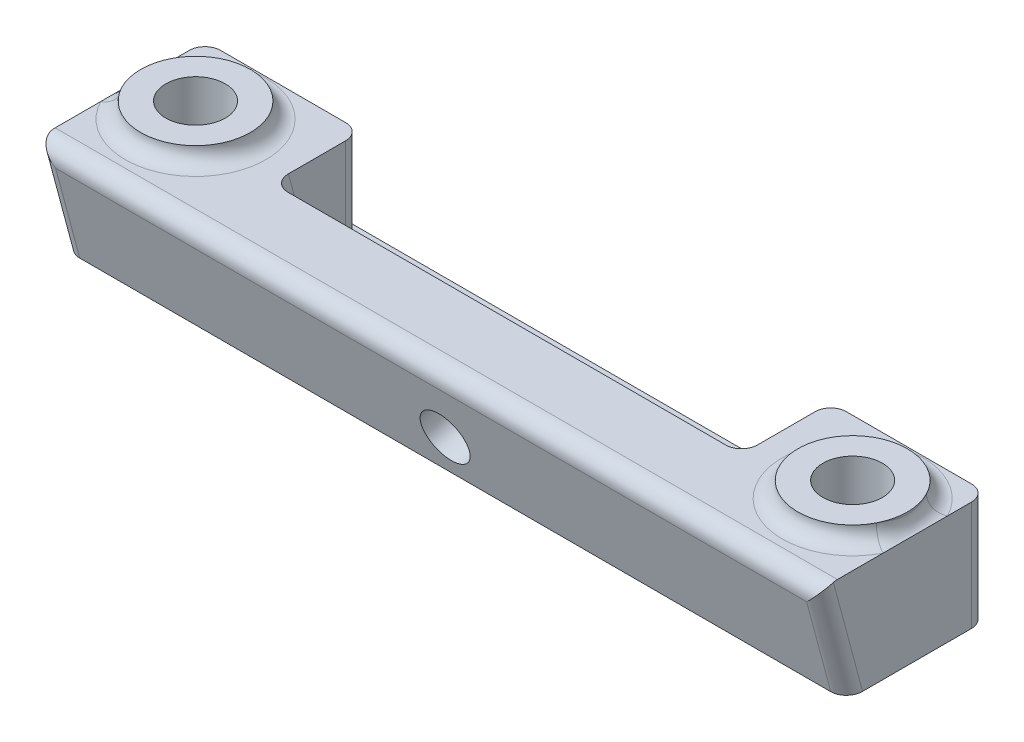
from build123d import *

# Parameters (mm, degrees)
BOSS_EXTRU_1_DEPTH      = 25
ESQUISSE2_R             = 1.55
ENL_V_MAT_EXTRU_1_DEPTH = 28.477263328
ENL_V_START             = -3
ESQUISSE3_R             = 1.9
ENL_V_MAT_EXTRU_2_DEPTH = 25.477263328
ESQUISSE4_R             = 3.5
ESQUISSE4_R_2           = 1.9
BOSS_EXTRU_2_DEPTH      = 8
ENL_V_MAT_EXTRU_3_DEPTH = 15
ESQUISSE7_R             = 1.55
ENL_V_MAT_EXTRU_4_DEPTH = 28.748873851
ENL_V_START_2           = -2
ESQUISSE8_R             = 1.9
ENL_V_MAT_EXTRU_5_DEPTH = 26.748873851
CONG_1_R                = 1
CONG_2_START            = -26
CONG_2_DEPTH            = 52


with BuildPart() as part:
    # Esquisse1 → Boss.-Extru.1 (new, symmetric)
    with BuildSketch(Plane(origin=(0, 0, 0), x_dir=(0, 0, -1), z_dir=(1, 0, 0))):
        Polygon((0, 0), (9, 0), (9, 7), (-1.875644347, 7), align=None)
    extrude(amount=BOSS_EXTRU_1_DEPTH, both=True)

    # Esquisse2 → Enlèv. mat.-Extru.1 (cut, through all)
    with BuildSketch(Plane.XZ):
        with Locations(Location((-21, -4.4, 0), (0, 0, 270))):
            Circle(ESQUISSE2_R)
        with Locations(Location((21, -4.4, 0), (0, 0, 90))):
            Circle(ESQUISSE2_R)
    extrude(amount=-ENL_V_MAT_EXTRU_1_DEPTH, mode=Mode.SUBTRACT)

    # Esquisse3 → Enlèv. mat.-Extru.2 (cut, through all)
    with BuildSketch(Plane.XZ.offset(ENL_V_START)):
        with Locations(Location((-21, -4.4, 0), (0, 0, 270))):
            Circle(ESQUISSE3_R)
        with Locations(Location((21, -4.4, 0), (0, 0, 270))):
            Circle(ESQUISSE3_R)
    extrude(amount=-ENL_V_MAT_EXTRU_2_DEPTH, mode=Mode.SUBTRACT)

    # Esquisse4 → Boss.-Extru.2 (add)
    # profile 1 of 2: a face of its own
    with BuildSketch(Plane(origin=(0, 0, 0), x_dir=(1, 0, 0), z_dir=(0, 1, 0))):
        with Locations(Location((-21, 4.4, 0), (0, 0, 90))):
            Circle(ESQUISSE4_R)
        with Locations(Location((-21, 4.4, 0), (0, 0, 90))):
            Circle(ESQUISSE4_R_2, mode=Mode.SUBTRACT)
    # profile 2 of 2: a face of its own
    with BuildSketch(Plane(origin=(0, 0, 0), x_dir=(1, 0, 0), z_dir=(0, 1, 0))):
        with Locations(Location((21, 4.4, 0), (0, 0, 90))):
            Circle(ESQUISSE4_R)
        with Locations(Location((21, 4.4, 0), (0, 0, 90))):
            Circle(ESQUISSE4_R_2, mode=Mode.SUBTRACT)
    extrude(amount=BOSS_EXTRU_2_DEPTH)

    # Esquisse6 → Enlèv. mat.-Extru.3 (cut, symmetric)
    with BuildSketch(Plane(origin=(0, 0, 0), x_dir=(0, 0, -1), z_dir=(1, 0, 0))):
        Polygon((3.300736555, 7), (4.747662194, 1.6), (9, 1.6), (9, 7), align=None)
    extrude(amount=ENL_V_MAT_EXTRU_3_DEPTH, both=True, mode=Mode.SUBTRACT)

    # Esquisse7 → Enlèv. mat.-Extru.4 (cut, through all)
    with BuildSketch(Plane(origin=(0, 0, 0), x_dir=(1, 0, 0), z_dir=(0, -0.25881904510252496, 0.9659258262890672))):
        with Locations(Location((0, 2.5, 0), (0, 0, 270))):
            Circle(ESQUISSE7_R)
    extrude(amount=-ENL_V_MAT_EXTRU_4_DEPTH, mode=Mode.SUBTRACT)

    # Esquisse8 → Enlèv. mat.-Extru.5 (cut, through all)
    with BuildSketch(Plane(origin=(0, 0, 0), x_dir=(1, 0, 0), z_dir=(0, -0.25881904510252496, 0.9659258262890672)).offset(ENL_V_START_2)):
        with Locations(Location((0, 2.5, 0), (0, 0, 270))):
            Circle(ESQUISSE8_R)
    extrude(amount=-ENL_V_MAT_EXTRU_5_DEPTH, mode=Mode.SUBTRACT)

    # Congé1
    cong_1_edges = [part.edges().sort_by_distance(p)[0] for p in [
        (25, 3.5, -9),
        (-21, 7, -0.9),
        (25, 3.5, 0.937822174),
        (21, 7, -0.9),
        (-25, 3.5, -9),
        (-25, 3.5, 0.937822174),
        (-15, 4.3, -9),
        (-15, 4.3, -4.024199375),
        (15, 4.3, -9),
        (15, 4.3, -4.024199375),
    ]]
    fillet(cong_1_edges, radius=CONG_1_R - 0.0001)  # a hair under: the kernel refuses the full size

    # Congé2: read off the stored shape, not the designer's step
    # Congé2 outline → Congé2 (cut)
    with BuildSketch(Plane.YZ.offset(CONG_2_START)):
        with BuildLine():
            Line((7, 1.875644347), (5.741180955, 1.5383448))
            ThreePointArc((5.741180955, 1.5383448), (6.608761429, 1.365772314), (7, 0.572418974))
            Line((7, 0.572418974), (7, 1.875644347))
        make_face()
    extrude(amount=CONG_2_DEPTH, mode=Mode.SUBTRACT)


solid = part.part
